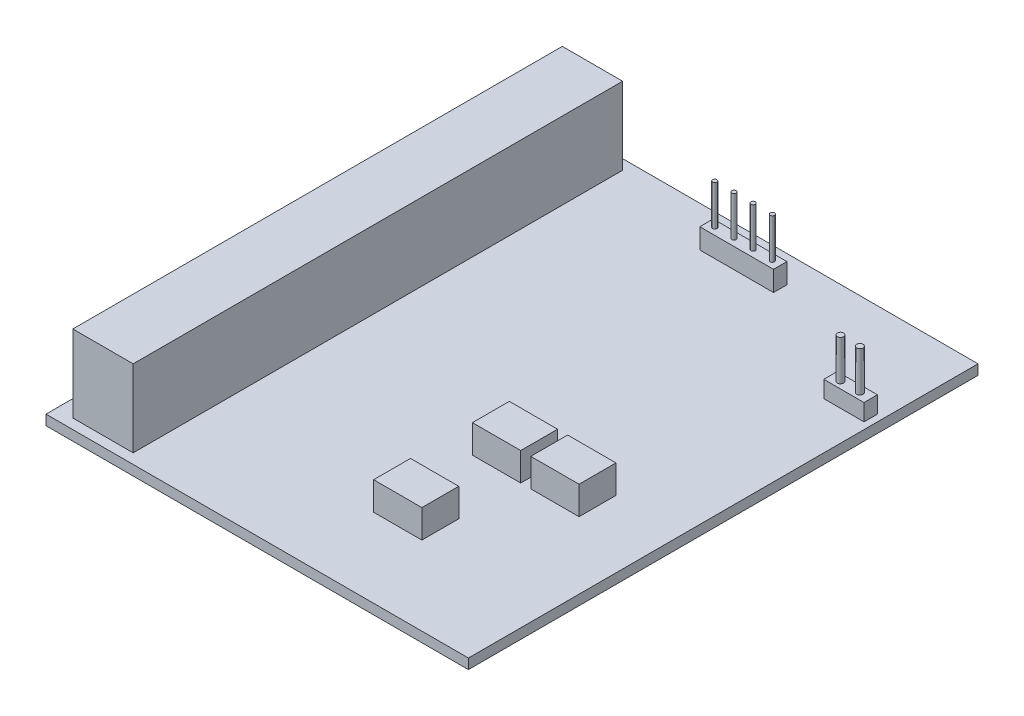
from build123d import *

# Parameters (mm, degrees)
SKETCH1_W           = 63
SKETCH1_H           = 76
BOSS_EXTRUDE1_DEPTH = 1.5
SKETCH2_W           = 9
SKETCH2_H           = 73
BOSS_EXTRUDE2_DEPTH = 11.5
SKETCH3_W           = 7
SKETCH3_H           = 8
BOSS_EXTRUDE3_DEPTH = 3.5
SKETCH4_W           = 11
SKETCH4_H           = 2
BOSS_EXTRUDE4_DEPTH = 3
SKETCH5_R           = 0.325
BOSS_EXTRUDE5_DEPTH = 6
SKETCH6_W           = 6
SKETCH6_H           = 2
BOSS_EXTRUDE6_DEPTH = 2.5
SKETCH7_R           = 0.473098864
BOSS_EXTRUDE7_DEPTH = 6
SKETCH8_W           = 7.2
SKETCH8_H           = 5.5
BOSS_EXTRUDE8_DEPTH = 4.2


with BuildPart() as part:
    # Sketch1 → Boss-Extrude1 (new body)
    with BuildSketch(Plane(origin=(0, 0, 0), x_dir=(1, 0, 0), z_dir=(0, 1, 0))):
        with Locations((31.5, 38)):
            Rectangle(SKETCH1_W, SKETCH1_H)
    extrude(amount=BOSS_EXTRUDE1_DEPTH)

    # Sketch2 → Boss-Extrude2 (add)
    with BuildSketch(Plane(origin=(0, 1.5, 0), x_dir=(1, 0, 0), z_dir=(0, 1, 0))):
        with Locations((7, 38)):
            Rectangle(SKETCH2_W, SKETCH2_H)
    extrude(amount=BOSS_EXTRUDE2_DEPTH)

    # Sketch3 → Boss-Extrude3 (add)
    with BuildSketch(Plane.XZ):
        with Locations((12.5, -19)):
            Rectangle(SKETCH3_W, SKETCH3_H)
        with Locations((12.5, -38)):
            Rectangle(SKETCH3_W, SKETCH3_H)
        with Locations((12.5, -60)):
            Rectangle(SKETCH3_W, SKETCH3_H)
    extrude(amount=BOSS_EXTRUDE3_DEPTH)

    # Sketch4 → Boss-Extrude4 (add)
    with BuildSketch(Plane(origin=(0, 1.5, 0), x_dir=(1, 0, 0), z_dir=(0, 1, 0))):
        with Locations((33.044731703, 70.957425383)):
            Rectangle(SKETCH4_W, SKETCH4_H)
    extrude(amount=BOSS_EXTRUDE4_DEPTH)

    # Sketch5 → Boss-Extrude5 (add)
    with BuildSketch(Plane(origin=(0, 4.5, 0), x_dir=(1, 0, 0), z_dir=(0, 1, 0))):
        with Locations((28.744731703, 71.003482199)):
            Circle(SKETCH5_R)
        with Locations((31.604731703, 71.003482199)):
            Circle(SKETCH5_R)
        with Locations((34.464731703, 71.003482199)):
            Circle(SKETCH5_R)
        with Locations((37.324731703, 71.003482199)):
            Circle(SKETCH5_R)
    extrude(amount=BOSS_EXTRUDE5_DEPTH)

    # Sketch6 → Boss-Extrude6 (add)
    with BuildSketch(Plane(origin=(0, 1.5, 0), x_dir=(1, 0, 0), z_dir=(0, 1, 0))):
        with Locations((59, 61)):
            Rectangle(SKETCH6_W, SKETCH6_H)
    extrude(amount=BOSS_EXTRUDE6_DEPTH)

    # Sketch7 → Boss-Extrude7 (add)
    with BuildSketch(Plane(origin=(0, 4, 0), x_dir=(1, 0, 0), z_dir=(0, 1, 0))):
        with Locations((57.5, 60.988988549)):
            Circle(SKETCH7_R)
        with Locations((60.4, 60.988988549)):
            Circle(SKETCH7_R)
    extrude(amount=BOSS_EXTRUDE7_DEPTH)

    # Sketch8 → Boss-Extrude8 (add)
    with BuildSketch(Plane(origin=(0, 1.5, 0), x_dir=(1, 0, 0), z_dir=(0, 1, 0))):
        with Locations((40.7, 29.25)):
            Rectangle(SKETCH8_W, SKETCH8_H)
        with Locations((49.4, 29.25)):
            Rectangle(SKETCH8_W, SKETCH8_H)
        with Locations((40.7, 14.51)):
            Rectangle(SKETCH8_W, SKETCH8_H)
    extrude(amount=BOSS_EXTRUDE8_DEPTH)


solid = part.part
